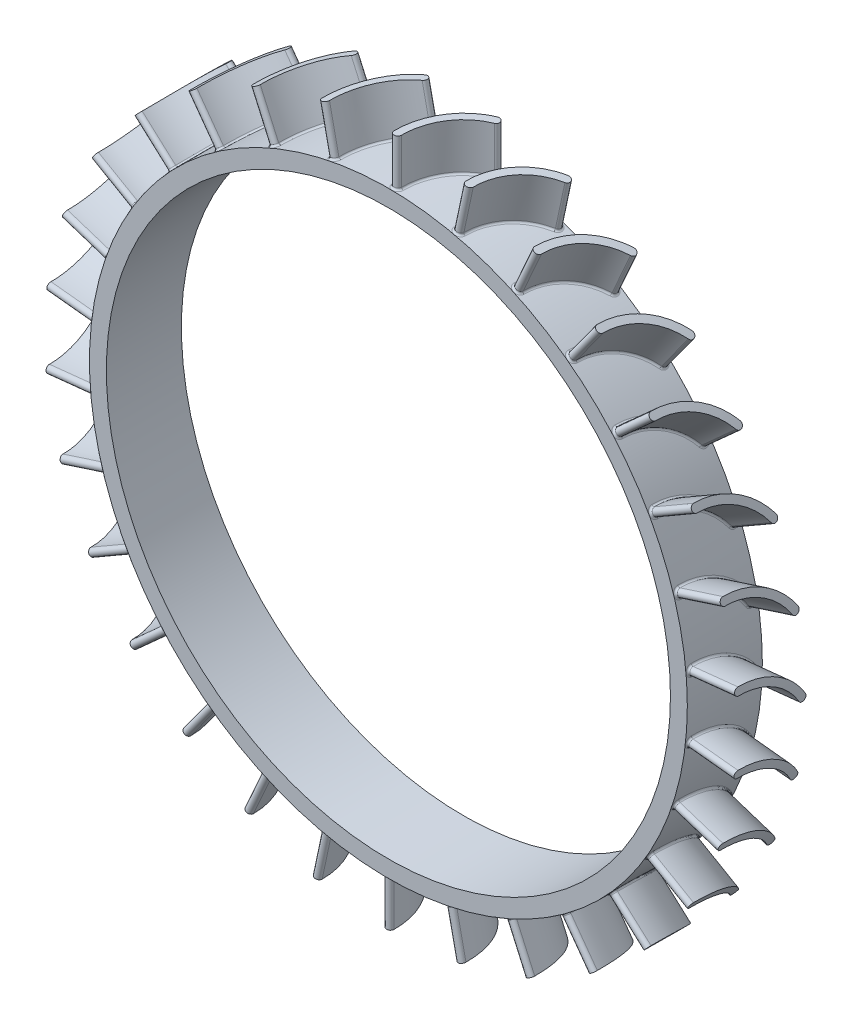
from build123d import *

# Parameters (mm, degrees)
SKETCH1_R                = 79.69
SKETCH1_R_2              = 75.19
BOSS_EXTRUDE1_DEPTH      = 10
BOSS_EXTRUDE2_REACH      = 192.141
BOSS_EXTRUDE2_END_RADIUS = 92.19
BOSS_EXTRUDE2_START      = 77
FILLET1_R                = 0.5
CIRPATTERN1_COUNT        = 30
FILLET1_OF_CIRPATTERN1_R = 0.5


with BuildPart() as part:
    # Sketch1 → Boss-Extrude1 (new, symmetric)
    with BuildSketch(Plane.XY):
        Circle(SKETCH1_R)
        Circle(SKETCH1_R_2, mode=Mode.SUBTRACT)
    extrude(amount=BOSS_EXTRUDE1_DEPTH, both=True)

    # Boss-Extrude2: up to this cylinder (the profile starts inside it)
    boss_extrude2_end = Plane(origin=(0, 0, -0.612504), z_dir=(0, 0, -1)) * Cylinder(BOSS_EXTRUDE2_END_RADIUS, 569.662, mode=Mode.PRIVATE)
    # Sketch2 → Boss-Extrude2 (add, up to the surface)
    with BuildSketch(Plane(origin=(0, 0, 0), x_dir=(1, 0, 0), z_dir=(0, 1, 0)).offset(BOSS_EXTRUDE2_START), mode=Mode.PRIVATE) as boss_extrude2_sk1:
        with BuildLine():
            ThreePointArc((-0.010577151, -8.5), (2.628333879, 1.603645999), (10, 9))
            ThreePointArc((10, 9), (11.365785831, 8.633081666), (10.998867497, 7.267295835))
            ThreePointArc((10.998867497, 7.267295835), (4.364367988, 0.610577234), (1.989348061, -8.482704165))
            ThreePointArc((1.989348061, -8.482704165), (0.998033372, -9.491314689), (-0.010577151, -8.5))
        make_face()
    boss_extrude2_tool1 = extrude(boss_extrude2_sk1.sketch, amount=BOSS_EXTRUDE2_REACH, mode=Mode.PRIVATE) & boss_extrude2_end
    boss_extrude2 = boss_extrude2_tool1.solids().sort_by_distance((4.360999, 77, -0.612504))[0]
    add(boss_extrude2)

    # Fillet1
    fillet1_edges = [part.edges().sort_by_distance(p)[0] for p in [
        (0.998084644, 79.683749454, 9.491314243),
        (4.370443678, 79.570065514, -0.621190071),
        (2.633289493, 79.646480714, -1.612304138),
        (2.633289493, 79.646480714, -1.612304138),
    ]]
    fillet(fillet1_edges, radius=FILLET1_R)

    # CirPattern1: Boss-Extrude2 ×30 about axis
    cirpattern1_axis = Axis((0, 0, 10), (0, 0, 1))
    for i in range(1, CIRPATTERN1_COUNT):
        add(boss_extrude2.rotate(cirpattern1_axis, i * 360 / CIRPATTERN1_COUNT))

    # Fillet1 of CirPattern1
    fillet1_of_cirpattern1_edges = [part.edges().sort_by_distance(p)[0] for p in [
        (-15.590908979, 78.149981812, 9.491314243),
        (-12.268607861, 78.739935007, -0.621190071),
        (-13.983688673, 78.453505688, -1.612304138),
        (-13.983688673, 78.453505688, -1.612304138),
        (-31.498505067, 73.200684959, 9.491314243),
        (-28.371462366, 74.468491505, -0.621190071),
        (-29.989512543, 73.831736002, -1.612304138),
        (-29.989512543, 73.831736002, -1.612304138),
        (-46.029465337, 65.052166918, 9.491314243),
        (-43.234347824, 66.942417584, -0.621190071),
        (-44.684650809, 65.983165169, -1.612304138),
        (-44.684650809, 65.983165169, -1.612304138),
        (-58.548717098, 54.060557028, 9.491314243),
        (-56.207684821, 56.49063879, -0.621190071),
        (-57.426855415, 55.250813395, -1.612304138),
        (-57.426855415, 55.250813395, -1.612304138),
        (-68.509108974, 40.706241384, 9.491314243),
        (-66.724476277, 43.569948008, -0.621190071),
        (-67.659230874, 42.103735954, -1.612304138),
        (-67.659230874, 42.103735954, -1.612304138),
        (-75.475324044, 25.572867662, 9.491314243),
        (-74.325087939, 28.745041426, -0.621190071),
        (-74.934573278, 27.116523215, -1.612304138),
        (-74.934573278, 27.116523215, -1.612304138),
        (-79.142905283, 9.32183691, 9.491314243),
        (-78.677336608, 12.663838601, -0.621190071),
        (-78.934915255, 10.944188292, -1.612304138),
        (-78.934915255, 10.944188292, -1.612304138),
        (-79.351561791, -7.336602845, 9.491314243),
        (-79.591008131, -3.97083474, -0.621190071),
        (-79.485422663, -5.706460176, -1.612304138),
        (-79.485422663, -5.706460176, -1.612304138),
        (-76.092174278, -23.674397852, 9.491314243),
        (-77.026170678, -20.431963548, -0.621190071),
        (-76.562035687, -22.107708951, -1.612304138),
        (-76.562035687, -22.107708951, -1.612304138),
        (-69.507193618, -38.97750807, 9.491314243),
        (-71.094919955, -36.000117506, -0.621190071),
        (-70.292520367, -37.54274476, -1.612304138),
        (-70.292520367, -37.54274476, -1.612304138),
        (-59.884415065, -52.57711415, 9.491314243),
        (-62.056480078, -49.994893581, -0.621190071),
        (-60.950884605, -51.336982473, -1.612304138),
        (-60.950884605, -51.336982473, -1.612304138),
        (-47.644400216, -63.878848049, 9.491314243),
        (-50.305874241, -61.804652904, -0.621190071),
        (-48.945402712, -62.88754771, -1.612304138),
        (-48.945402712, -62.88754771, -1.612304138),
        (-33.322096454, -72.388769764, 9.491314243),
        (-36.356660306, -70.913252324, -0.621190071),
        (-34.800771854, -71.689625345, -1.612304138),
        (-34.800771854, -71.689625345, -1.612304138),
        (-17.54345718, -77.73495488, 9.491314243),
        (-20.818485857, -76.922602338, -0.621190071),
        (-19.135180273, -77.358522346, -1.612304138),
        (-19.135180273, -77.358522346, -1.612304138),
        (-0.998084644, -79.683749454, 9.491314243),
        (-4.370443678, -79.570065514, -0.621190071),
        (-2.633289493, -79.646480714, -1.612304138),
        (-2.633289493, -79.646480714, -1.612304138),
        (15.590908979, -78.149981812, 9.491314243),
        (12.268607861, -78.739935007, -0.621190071),
        (13.983688673, -78.453505688, -1.612304138),
        (13.983688673, -78.453505688, -1.612304138),
        (31.498505067, -73.200684959, 9.491314243),
        (28.371462366, -74.468491505, -0.621190071),
        (29.989512543, -73.831736002, -1.612304138),
        (29.989512543, -73.831736002, -1.612304138),
        (46.029465337, -65.052166918, 9.491314243),
        (43.234347824, -66.942417584, -0.621190071),
        (44.684650809, -65.983165169, -1.612304138),
        (44.684650809, -65.983165169, -1.612304138),
        (58.548717098, -54.060557028, 9.491314243),
        (56.207684821, -56.49063879, -0.621190071),
        (57.426855415, -55.250813395, -1.612304138),
        (57.426855415, -55.250813395, -1.612304138),
        (68.509108974, -40.706241384, 9.491314243),
        (66.724476277, -43.569948008, -0.621190071),
        (67.659230874, -42.103735954, -1.612304138),
        (67.659230874, -42.103735954, -1.612304138),
        (75.475324044, -25.572867662, 9.491314243),
        (74.325087939, -28.745041426, -0.621190071),
        (74.934573278, -27.116523215, -1.612304138),
        (74.934573278, -27.116523215, -1.612304138),
        (79.142905283, -9.32183691, 9.491314243),
        (78.677336608, -12.663838601, -0.621190071),
        (78.934915255, -10.944188292, -1.612304138),
        (78.934915255, -10.944188292, -1.612304138),
        (79.351561791, 7.336602845, 9.491314243),
        (79.591008131, 3.97083474, -0.621190071),
        (79.485422663, 5.706460176, -1.612304138),
        (79.485422663, 5.706460176, -1.612304138),
        (76.092174278, 23.674397852, 9.491314243),
        (77.026170678, 20.431963548, -0.621190071),
        (76.562035687, 22.107708951, -1.612304138),
        (76.562035687, 22.107708951, -1.612304138),
        (69.507193618, 38.97750807, 9.491314243),
        (71.094919955, 36.000117506, -0.621190071),
        (70.292520367, 37.54274476, -1.612304138),
        (70.292520367, 37.54274476, -1.612304138),
        (59.884415065, 52.57711415, 9.491314243),
        (62.056480078, 49.994893581, -0.621190071),
        (60.950884605, 51.336982473, -1.612304138),
        (60.950884605, 51.336982473, -1.612304138),
        (47.644400216, 63.878848049, 9.491314243),
        (50.305874241, 61.804652904, -0.621190071),
        (48.945402712, 62.88754771, -1.612304138),
        (48.945402712, 62.88754771, -1.612304138),
        (33.322096454, 72.388769764, 9.491314243),
        (36.356660306, 70.913252324, -0.621190071),
        (34.800771854, 71.689625345, -1.612304138),
        (34.800771854, 71.689625345, -1.612304138),
        (17.54345718, 77.73495488, 9.491314243),
        (20.818485857, 76.922602338, -0.621190071),
        (19.135180273, 77.358522346, -1.612304138),
        (19.135180273, 77.358522346, -1.612304138),
    ]]
    fillet(fillet1_of_cirpattern1_edges, radius=FILLET1_OF_CIRPATTERN1_R)


solid = part.part
